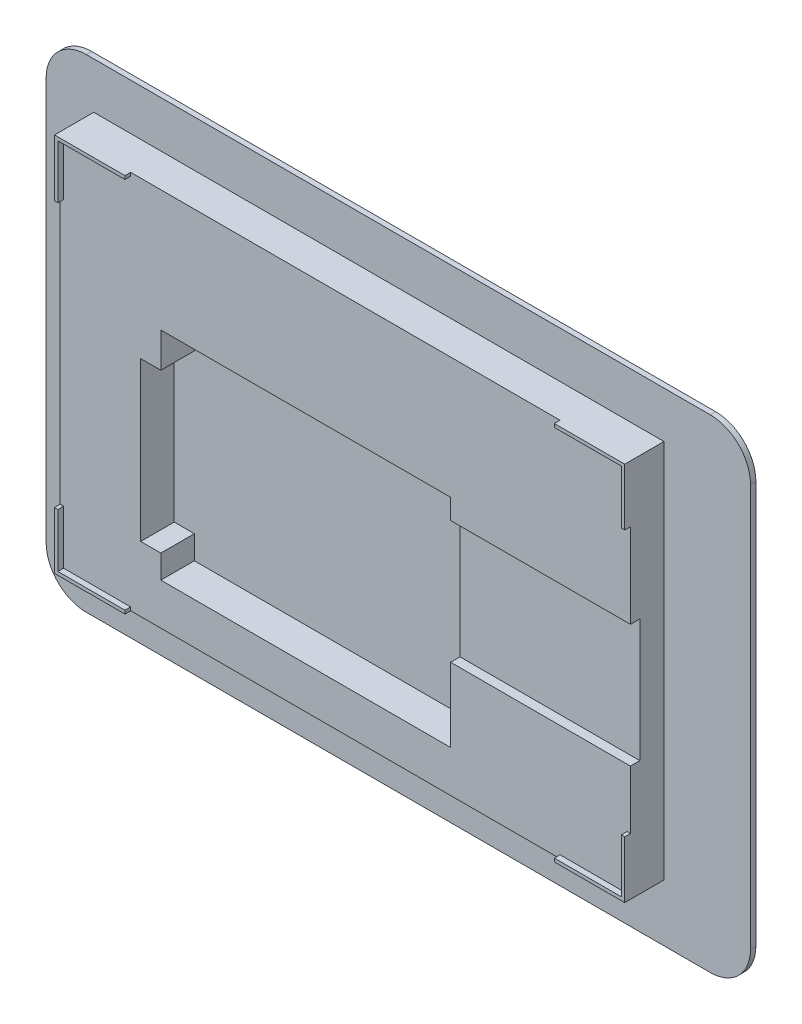
from build123d import *

# Parameters (mm, degrees)
CROQUIS1_W              = 85
CROQUIS1_H              = 56.6
SALIENTE_EXTRUIR1_DEPTH = 5
SALIENTE_EXTRUIR2_DEPTH = 0.85
CROQUIS3_W              = 83
CROQUIS3_H              = 54.6
SALIENTE_EXTRUIR3_DEPTH = 0.9
SALIENTE_EXTRUIR4_DEPTH = 0.8
CROQUIS5_W              = 75
CROQUIS5_H              = 50
CORTAR_EXTRUIR1_DEPTH   = 0.1
CROQUIS6_W              = 26.8
CROQUIS6_H              = 18.3
CORTAR_EXTRUIR2_DEPTH   = 1.4
CROQUIS7_W              = 2.1
CROQUIS7_H              = 42.6
CORTAR_EXTRUIR3_DEPTH   = 1
REDONDEO1_R             = 2.9
SALIENTE_EXTRUIR5_REACH = 117.643
CROQUIS8_W              = 3.7
CROQUIS8_H              = 6.5
REDONDEO2_R             = 2


with BuildPart() as part:
    # Croquis1 → Saliente-Extruir1 (new body)
    with BuildSketch(Plane.XY):
        with Locations((42.5, 28.3)):
            Rectangle(CROQUIS1_W, CROQUIS1_H)
        Polygon((12, 33.3), (12, 9.7), (15, 9.7), (15, 6.2), (58.2, 6.2), (58.2, 38.5), (15, 38.5), (15, 33.3), align=None, mode=Mode.SUBTRACT)
    extrude(amount=SALIENTE_EXTRUIR1_DEPTH)

    # Croquis2 → Saliente-Extruir2 (add)
    with BuildSketch(Plane.XY.offset(5)):
        Polygon((0, 56.6), (10.5, 56.6), (10.5, 56.1), (0.5, 56.1), (0.5, 48.1), (0, 48.1), align=None)
        Polygon((85, 48.1), (85, 56.6), (74.5, 56.6), (74.5, 56.1), (84.5, 56.1), (84.5, 48.1), align=None)
        Polygon((85, 0), (74.5, 0), (74.5, 0.5), (84.5, 0.5), (84.5, 8.5), (85, 8.5), align=None)
        Polygon((0, 8.5), (0, 0), (10.5, 0), (10.5, 0.5), (0.5, 0.5), (0.5, 8.5), align=None)
    extrude(amount=SALIENTE_EXTRUIR2_DEPTH)

    # Croquis3 → Saliente-Extruir3 (add)
    with BuildSketch(Plane(origin=(0, 0, 0), x_dir=(-1, 0, 0), z_dir=(0, 0, -1))):
        with Locations((-42.5, 28.3)):
            Rectangle(CROQUIS3_W, CROQUIS3_H)
    extrude(amount=SALIENTE_EXTRUIR3_DEPTH)

    # Croquis4 → Saliente-Extruir4 (add)
    with BuildSketch(Plane(origin=(0, 0, -0.9), x_dir=(-1, 0, 0), z_dir=(0, 0, -1))):
        with BuildLine():
            Line((-91, 62.6), (2, 62.6))
            ThreePointArc((2, 62.6), (6.242640687, 60.842640687), (8, 56.6))
            Line((8, 56.6), (8, -3.4))
            ThreePointArc((8, -3.4), (6.242640687, -7.642640687), (2, -9.4))
            Line((2, -9.4), (-91, -9.4))
            ThreePointArc((-91, -9.4), (-95.242640687, -7.642640687), (-97, -3.4))
            Line((-97, -3.4), (-97, 56.6))
            ThreePointArc((-97, 56.6), (-95.242640687, 60.842640687), (-91, 62.6))
        make_face()
    extrude(amount=SALIENTE_EXTRUIR4_DEPTH)

    # Croquis5 → Cortar-Extruir1 (cut)
    with BuildSketch(Plane(origin=(0, 0, -1.7), x_dir=(-1, 0, 0), z_dir=(0, 0, -1))):
        with Locations((-44.5, 26.6)):
            Rectangle(CROQUIS5_W, CROQUIS5_H)
    extrude(amount=-CORTAR_EXTRUIR1_DEPTH, mode=Mode.SUBTRACT)

    # Croquis6 → Cortar-Extruir2 (cut)
    with BuildSketch(Plane.XY.offset(5)):
        with Locations((71.6, 26.35)):
            Rectangle(CROQUIS6_W, CROQUIS6_H)
    extrude(amount=-CORTAR_EXTRUIR2_DEPTH, mode=Mode.SUBTRACT)

    # Croquis7 → Cortar-Extruir3 (cut)
    with BuildSketch(Plane.ZY):
        with Locations((1.05, 28.3)):
            Rectangle(CROQUIS7_W, CROQUIS7_H)
    extrude(amount=-CORTAR_EXTRUIR3_DEPTH, mode=Mode.SUBTRACT)

    # Redondeo1
    # the kernel refuses this fillet: 2.9 mm, written as the material it adds along each edge
    with BuildSketch(Plane(origin=(0, 7, 2.1), x_dir=(0, 0, -1), z_dir=(1, 0, 0))) as redondeo1_piece_1:
        with BuildLine():
            CenterArc((2.9, 2.787471973), REDONDEO1_R, 180, 73.986605576)
            Line((0, 2.787471973), (-0.058, 2.787471973))
            Line((-0.058, 2.787471973), (-0.058, 0))
            Line((-0.058, 0), (0, -0.058))
            ThreePointArc((0, -0.058), (1.05, -0.058), (2.084, -0.055749439))
            Line((2.084, -0.055749439), (2.1, 0))
        make_face()
    extrude(amount=7.968679932)
    with BuildSketch(Plane(origin=(0, 49.6, 2.1), x_dir=(0, 0, -1), z_dir=(1, 0, 0))) as redondeo1_piece_2:
        with BuildLine():
            CenterArc((2.9, -2.787471973), REDONDEO1_R, 106.013394424, 73.986605576)
            Line((0, -2.787471973), (-0.058, -2.787471973))
            Line((-0.058, -2.787471973), (-0.058, 0))
            Line((-0.058, 0), (0, 0.058))
            ThreePointArc((0, 0.058), (1.05, 0.058), (2.084, 0.055749439))
            Line((2.084, 0.055749439), (2.1, 0))
        make_face()
    extrude(amount=7.968679932)

    # Saliente-Extruir5: up to this face of the body (flat: up to its plane)
    saliente_extruir5_end = Plane(part.part.faces().sort_by_distance((0.5, 28.3, 2.1))[0])
    # Croquis8 → Saliente-Extruir5 (add, up to the picked face)
    with BuildSketch(Plane.XY.offset(-0.9), mode=Mode.PRIVATE) as saliente_extruir5_sk1:
        with Locations((-0.85, 44.35)):
            Rectangle(CROQUIS8_W, CROQUIS8_H)
    saliente_extruir5_tool1 = split(extrude(saliente_extruir5_sk1.sketch, amount=SALIENTE_EXTRUIR5_REACH, mode=Mode.PRIVATE), bisect_by=saliente_extruir5_end, keep=Keep.BOTH, mode=Mode.PRIVATE)
    # Croquis8 → Saliente-Extruir5 (add, up to the picked face)
    with BuildSketch(Plane.XY.offset(-0.9), mode=Mode.PRIVATE) as saliente_extruir5_sk2:
        with Locations((-0.85, 12.25)):
            Rectangle(CROQUIS8_W, CROQUIS8_H)
    saliente_extruir5_tool2 = split(extrude(saliente_extruir5_sk2.sketch, amount=SALIENTE_EXTRUIR5_REACH, mode=Mode.PRIVATE), bisect_by=saliente_extruir5_end, keep=Keep.BOTH, mode=Mode.PRIVATE)
    add(saliente_extruir5_tool1.solids().sort_by(Axis((-0.85, 44.35, -0.9), (0, 0, 1)))[0])
    add(saliente_extruir5_tool2.solids().sort_by(Axis((-0.85, 12.25, -0.9), (0, 0, 1)))[0])

    # Redondeo2
    redondeo2_edges = [part.edges().sort_by_distance(p)[0] for p in [
        (-2.7, 44.35, 2.1),
        (-2.7, 12.25, 2.1),
    ]]
    fillet(redondeo2_edges, radius=REDONDEO2_R)


solid = part.part
